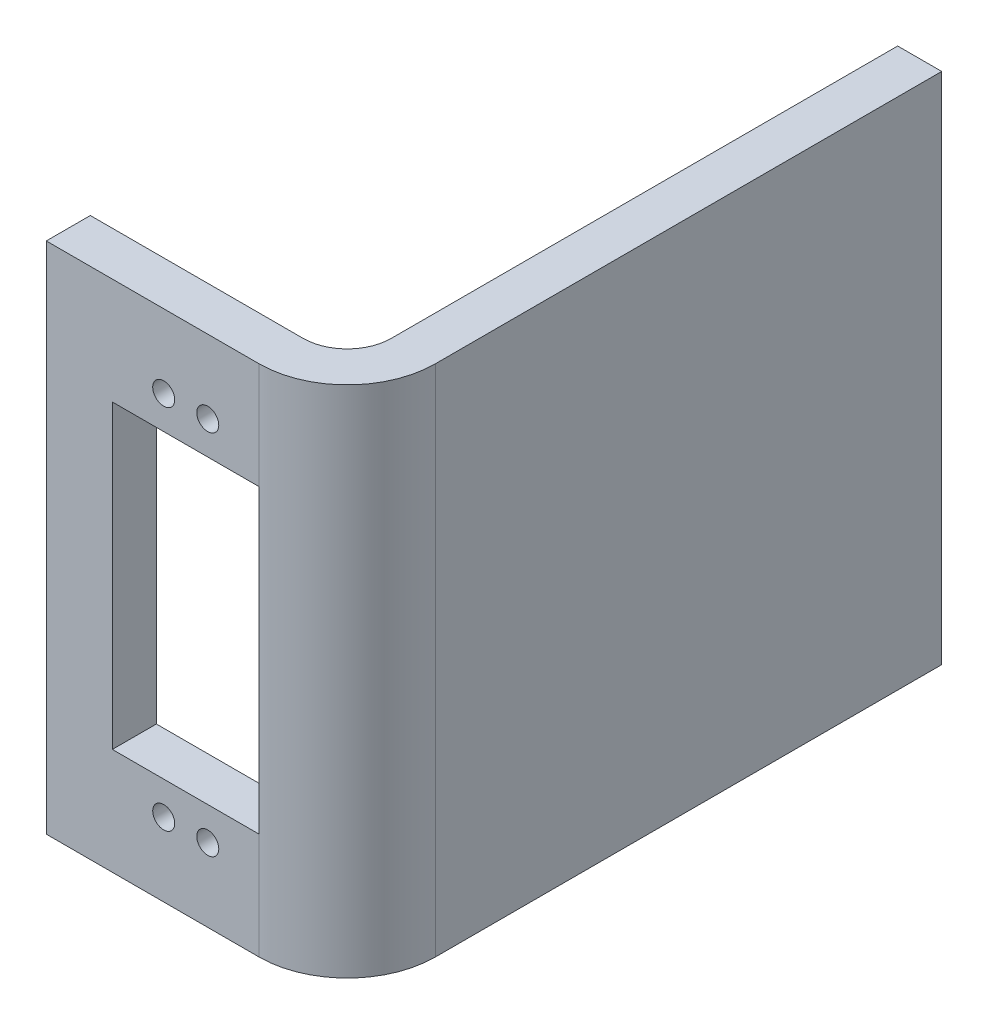
from build123d import *

# Parameters (mm, degrees)
BOSS_EXTRUDE1_DEPTH = 70
SKETCH3_R           = 1.5
SKETCH3_W           = 20
SKETCH3_H           = 41
CUT_EXTRUDE1_DEPTH  = 50


with BuildPart() as part:
    # Sketch2 → Boss-Extrude1 (new body)
    with BuildSketch(Plane(origin=(0, 0, 0), x_dir=(1, 0, 0), z_dir=(0, 1, 0))):
        with BuildLine():
            Line((6, -69), (6, 0))
            Line((6, 0), (0, 0))
            Line((0, 0), (0, -69))
            ThreePointArc((0, -69), (-1.757359313, -73.242640687), (-6, -75))
            Line((-6, -75), (-35, -75))
            Line((-35, -75), (-35, -81))
            Line((-35, -81), (-6, -81))
            ThreePointArc((-6, -81), (2.485281374, -77.485281374), (6, -69))
        make_face()
    extrude(amount=BOSS_EXTRUDE1_DEPTH)

    # Sketch3 → Cut-Extrude1 (cut)
    with BuildSketch(Plane.XY.offset(81)):
        with Locations((-19, 60)):
            Circle(SKETCH3_R)
        with Locations((-13, 60)):
            Circle(SKETCH3_R)
        with Locations((-13, 10)):
            Circle(SKETCH3_R)
        with Locations((-19, 10)):
            Circle(SKETCH3_R)
        with Locations((-16, 35)):
            Rectangle(SKETCH3_W, SKETCH3_H)
    extrude(amount=-CUT_EXTRUDE1_DEPTH, mode=Mode.SUBTRACT)


solid = part.part
